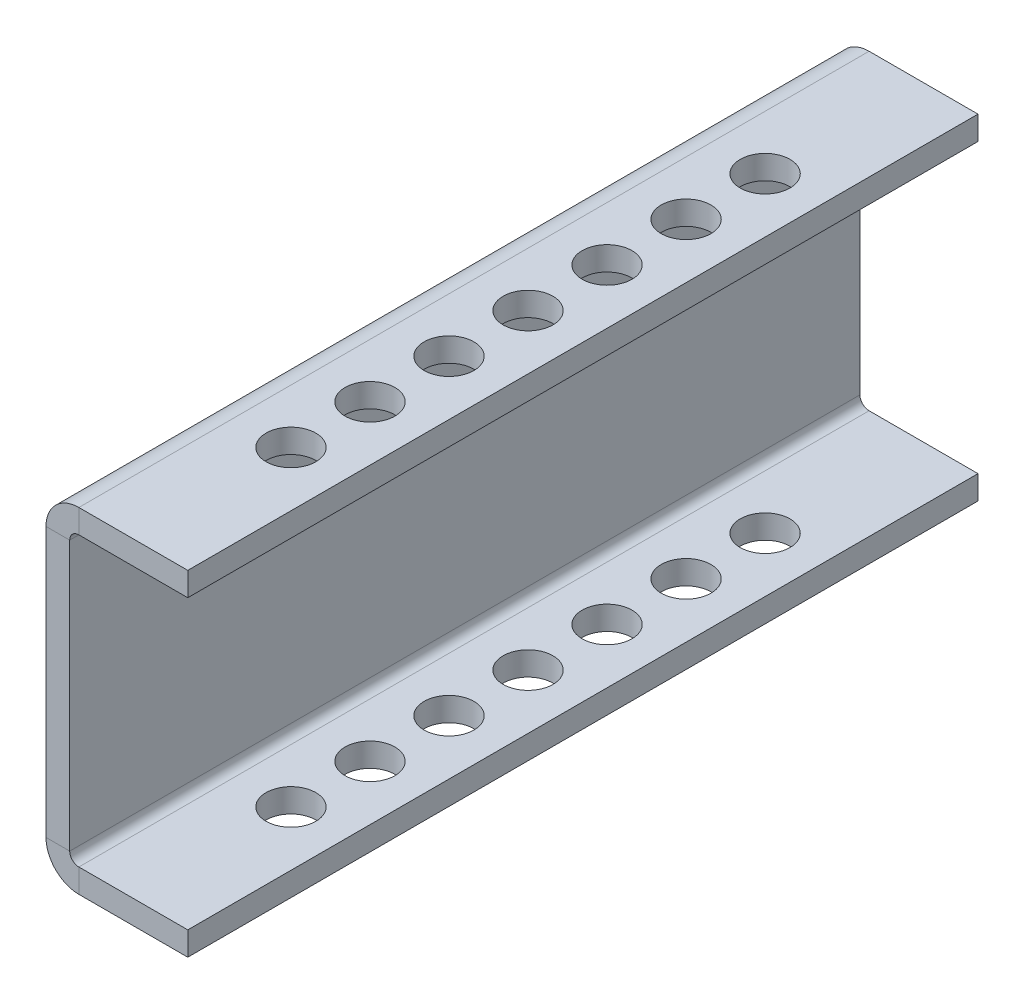
from build123d import *

# Parameters (mm, degrees)
SKETCH4_W              = 63.5
SKETCH4_H              = 44.45
BASE_FLANGE1_DEPTH     = 1.905
SKETCHED_START         = -31.75
SKETCHED_BEND3_DEPTH   = 63.5
SKETCHED_BEND3_2_DEPTH = 63.5
CUT_EXTRUDE2_REACH     = 44.696
SKETCH20_R             = 2


# Read off the part's stored shape, not the designer's step: Sketched Bend3
# Sheet-metal steps are written as plain solids
with BuildPart() as part:
    # Sketch4 → Base-Flange1 (new body)
    with BuildSketch(Plane(origin=(0, 0, 0), x_dir=(0, 0, -1), z_dir=(1, 0, 0))):
        Rectangle(SKETCH4_W, SKETCH4_H)
    extrude(amount=-BASE_FLANGE1_DEPTH)

    # Sketched Bend3 outline → Sketched Bend3 (cut)
    with BuildSketch(Plane.XY.offset(SKETCHED_START)):
        with BuildLine():
            ThreePointArc((0, -13.357223013), (-1.375727285, -12.406629491), (-1.905, -10.8204))
            Line((-1.905, -10.8204), (-1.905, -22.225))
            Line((-1.905, -22.225), (0, -22.225))
            Line((0, -22.225), (0, -13.357223013))
        make_face()
        with BuildLine():
            Line((-1.905, 22.225), (-1.905, 10.8204))
            ThreePointArc((-1.905, 10.8204), (-1.375727285, 12.406629491), (0, 13.357223013))
            Line((0, 13.357223013), (0, 22.225))
            Line((0, 22.225), (-1.905, 22.225))
        make_face()
    extrude(amount=SKETCHED_BEND3_DEPTH, mode=Mode.SUBTRACT)

    # Sketched Bend3 2 outline → Sketched Bend3 2 (add)
    with BuildSketch(Plane.XY.offset(SKETCHED_START)):
        with BuildLine():
            Line((0, -10.8204), (0, -13.357223013))
            ThreePointArc((0, -13.357223013), (0.364592683, -13.435674577), (0.7366, -13.462))
            Line((0.7366, -13.462), (9.487967924, -13.462))
            Line((9.487967924, -13.462), (9.487967924, -11.557))
            Line((9.487967924, -11.557), (0.7366, -11.557))
            ThreePointArc((0.7366, -11.557), (0.215745145, -11.341254855), (0, -10.8204))
        make_face()
        with BuildLine():
            ThreePointArc((0.7366, 13.462), (0.364592683, 13.435674577), (0, 13.357223013))
            Line((0, 13.357223013), (0, 10.8204))
            ThreePointArc((0, 10.8204), (0.215745145, 11.341254855), (0.7366, 11.557))
            Line((0.7366, 11.557), (9.487967924, 11.557))
            Line((9.487967924, 11.557), (9.487967924, 13.462))
            Line((9.487967924, 13.462), (0.7366, 13.462))
        make_face()
    extrude(amount=SKETCHED_BEND3_2_DEPTH)

    # Cut-Extrude2: up to this face of the body (flat: up to its plane)
    cut_extrude2_end = Plane(part.part.faces().sort_by_distance((5.112283962, -13.462, 0))[0])
    # Sketch20 → Cut-Extrude2 (cut, up to the picked face)
    with BuildSketch(Plane(origin=(0, 13.462, 0), x_dir=(1, 0, 0), z_dir=(0, 1, 0)), mode=Mode.PRIVATE) as cut_extrude2_sk1:
        with Locations(Location((5.08, 0, 0), (0, 0, 180))):
            Circle(SKETCH20_R)
    cut_extrude2_tool1 = split(extrude(cut_extrude2_sk1.sketch, amount=-CUT_EXTRUDE2_REACH, mode=Mode.PRIVATE), bisect_by=cut_extrude2_end, keep=Keep.BOTH, mode=Mode.PRIVATE)
    # Sketch20 → Cut-Extrude2 (cut, up to the picked face)
    with BuildSketch(Plane(origin=(0, 13.462, 0), x_dir=(1, 0, 0), z_dir=(0, 1, 0)), mode=Mode.PRIVATE) as cut_extrude2_sk2:
        with Locations(Location((5.08, 6.35, 0), (0, 0, 180))):
            Circle(SKETCH20_R)
    cut_extrude2_tool2 = split(extrude(cut_extrude2_sk2.sketch, amount=-CUT_EXTRUDE2_REACH, mode=Mode.PRIVATE), bisect_by=cut_extrude2_end, keep=Keep.BOTH, mode=Mode.PRIVATE)
    # Sketch20 → Cut-Extrude2 (cut, up to the picked face)
    with BuildSketch(Plane(origin=(0, 13.462, 0), x_dir=(1, 0, 0), z_dir=(0, 1, 0)), mode=Mode.PRIVATE) as cut_extrude2_sk3:
        with Locations(Location((5.08, 12.7, 0), (0, 0, 180))):
            Circle(SKETCH20_R)
    cut_extrude2_tool3 = split(extrude(cut_extrude2_sk3.sketch, amount=-CUT_EXTRUDE2_REACH, mode=Mode.PRIVATE), bisect_by=cut_extrude2_end, keep=Keep.BOTH, mode=Mode.PRIVATE)
    # Sketch20 → Cut-Extrude2 (cut, up to the picked face)
    with BuildSketch(Plane(origin=(0, 13.462, 0), x_dir=(1, 0, 0), z_dir=(0, 1, 0)), mode=Mode.PRIVATE) as cut_extrude2_sk4:
        with Locations(Location((5.08, 19.05, 0), (0, 0, 180))):
            Circle(SKETCH20_R)
    cut_extrude2_tool4 = split(extrude(cut_extrude2_sk4.sketch, amount=-CUT_EXTRUDE2_REACH, mode=Mode.PRIVATE), bisect_by=cut_extrude2_end, keep=Keep.BOTH, mode=Mode.PRIVATE)
    # Sketch20 → Cut-Extrude2 (cut, up to the picked face)
    with BuildSketch(Plane(origin=(0, 13.462, 0), x_dir=(1, 0, 0), z_dir=(0, 1, 0)), mode=Mode.PRIVATE) as cut_extrude2_sk5:
        with Locations(Location((5.08, -6.35, 0), (0, 0, 180))):
            Circle(SKETCH20_R)
    cut_extrude2_tool5 = split(extrude(cut_extrude2_sk5.sketch, amount=-CUT_EXTRUDE2_REACH, mode=Mode.PRIVATE), bisect_by=cut_extrude2_end, keep=Keep.BOTH, mode=Mode.PRIVATE)
    # Sketch20 → Cut-Extrude2 (cut, up to the picked face)
    with BuildSketch(Plane(origin=(0, 13.462, 0), x_dir=(1, 0, 0), z_dir=(0, 1, 0)), mode=Mode.PRIVATE) as cut_extrude2_sk6:
        with Locations(Location((5.08, -12.7, 0), (0, 0, 180))):
            Circle(SKETCH20_R)
    cut_extrude2_tool6 = split(extrude(cut_extrude2_sk6.sketch, amount=-CUT_EXTRUDE2_REACH, mode=Mode.PRIVATE), bisect_by=cut_extrude2_end, keep=Keep.BOTH, mode=Mode.PRIVATE)
    # Sketch20 → Cut-Extrude2 (cut, up to the picked face)
    with BuildSketch(Plane(origin=(0, 13.462, 0), x_dir=(1, 0, 0), z_dir=(0, 1, 0)), mode=Mode.PRIVATE) as cut_extrude2_sk7:
        with Locations(Location((5.08, -19.05, 0), (0, 0, 180))):
            Circle(SKETCH20_R)
    cut_extrude2_tool7 = split(extrude(cut_extrude2_sk7.sketch, amount=-CUT_EXTRUDE2_REACH, mode=Mode.PRIVATE), bisect_by=cut_extrude2_end, keep=Keep.BOTH, mode=Mode.PRIVATE)
    add(cut_extrude2_tool1.solids().sort_by(Axis((5.08, 13.462, 0), (0, -1, 0)))[0], mode=Mode.SUBTRACT)
    add(cut_extrude2_tool2.solids().sort_by(Axis((5.08, 13.462, -6.35), (0, -1, 0)))[0], mode=Mode.SUBTRACT)
    add(cut_extrude2_tool3.solids().sort_by(Axis((5.08, 13.462, -12.7), (0, -1, 0)))[0], mode=Mode.SUBTRACT)
    add(cut_extrude2_tool4.solids().sort_by(Axis((5.08, 13.462, -19.05), (0, -1, 0)))[0], mode=Mode.SUBTRACT)
    add(cut_extrude2_tool5.solids().sort_by(Axis((5.08, 13.462, 6.35), (0, -1, 0)))[0], mode=Mode.SUBTRACT)
    add(cut_extrude2_tool6.solids().sort_by(Axis((5.08, 13.462, 12.7), (0, -1, 0)))[0], mode=Mode.SUBTRACT)
    add(cut_extrude2_tool7.solids().sort_by(Axis((5.08, 13.462, 19.05), (0, -1, 0)))[0], mode=Mode.SUBTRACT)


solid = part.part
